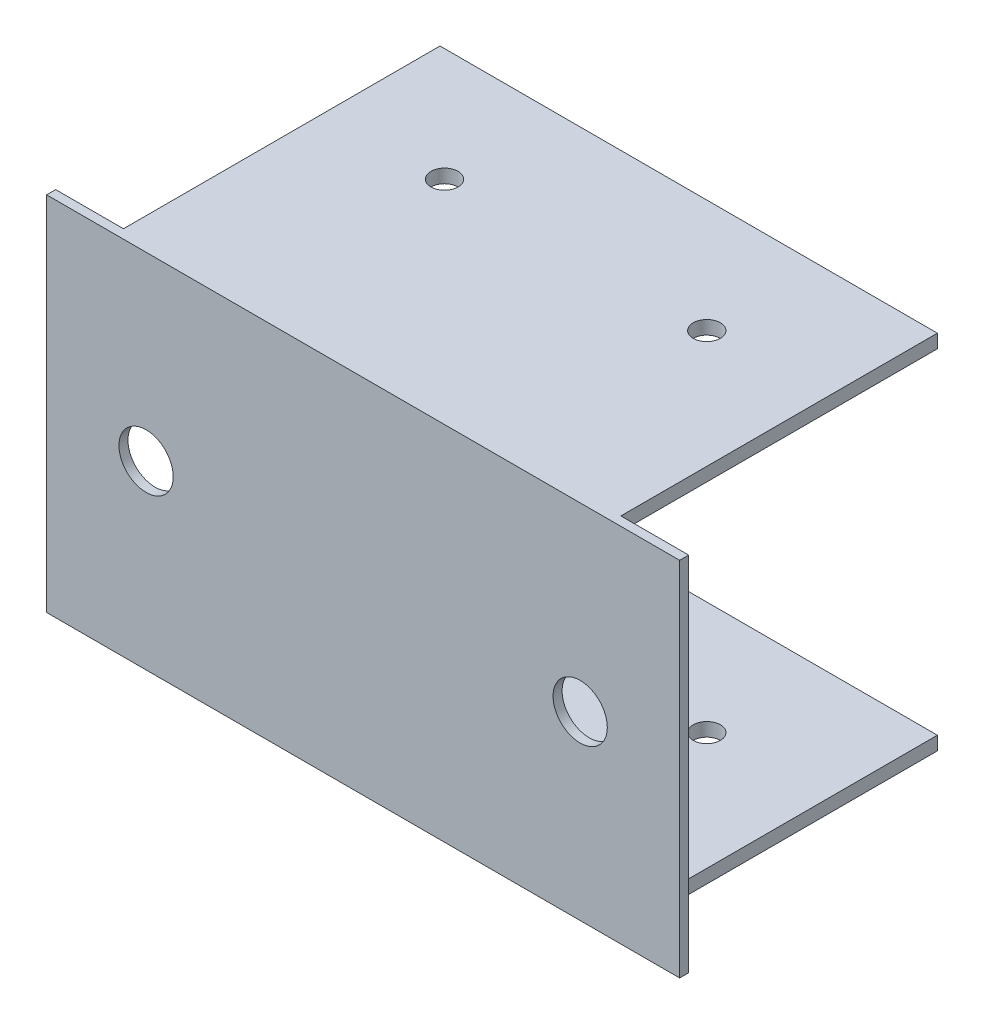
from build123d import *

# Parameters (mm, degrees)
SKETCH_1_W          = 70
SKETCH_1_H          = 40
EXTRUDE_1_DEPTH     = 1
SKETCH_2_R          = 3
CUT_EXTRUDE_1_DEPTH = 10
SKETCH_4_W          = 55
SKETCH_4_H          = 36
EXTRUDE_2_DEPTH     = 1.5
EXTRUDE_START       = -40
SKETCH_4_2_W        = 55
SKETCH_4_2_H        = 36
EXTRUDE_3_DEPTH     = 1.5
SKETCH_5_R          = 1.5
CUT_EXTRUDE_2_DEPTH = 64.639610307


with BuildPart() as part:
    # 草图1 → 凸台-拉伸1 (new body)
    with BuildSketch(Plane.XY):
        Rectangle(SKETCH_1_W, SKETCH_1_H)
    extrude(amount=EXTRUDE_1_DEPTH)

    # 草图2 → 切除-拉伸1 (cut)
    with BuildSketch(Plane.XY.offset(1)):
        with Locations((-24, 0)):
            Circle(SKETCH_2_R)
        with Locations((24, 0)):
            Circle(SKETCH_2_R)
    extrude(amount=-CUT_EXTRUDE_1_DEPTH, mode=Mode.SUBTRACT)

    # 草图4 → 凸台-拉伸2 (add)
    with BuildSketch(Plane(origin=(0, 20, 0), x_dir=(1, 0, 0), z_dir=(0, 1, 0))):
        with Locations((0, 17)):
            Rectangle(SKETCH_4_W, SKETCH_4_H)
    extrude(amount=-EXTRUDE_2_DEPTH)

    # 草图4<2> → 凸台-拉伸3 (add)
    with BuildSketch(Plane(origin=(0, 20, 0), x_dir=(1, 0, 0), z_dir=(0, 1, 0)).offset(EXTRUDE_START)):
        with Locations((0, 17)):
            Rectangle(SKETCH_4_2_W, SKETCH_4_2_H)
    extrude(amount=EXTRUDE_3_DEPTH)

    # 草图5 → 切除-拉伸2 (cut, through all)
    with BuildSketch(Plane(origin=(0, 20, 0), x_dir=(1, 0, 0), z_dir=(0, 1, 0))):
        with Locations((-14.5, 22.5)):
            Circle(SKETCH_5_R)
        with Locations((14.5, 22.5)):
            Circle(SKETCH_5_R)
    extrude(amount=-CUT_EXTRUDE_2_DEPTH, mode=Mode.SUBTRACT)


solid = part.part
